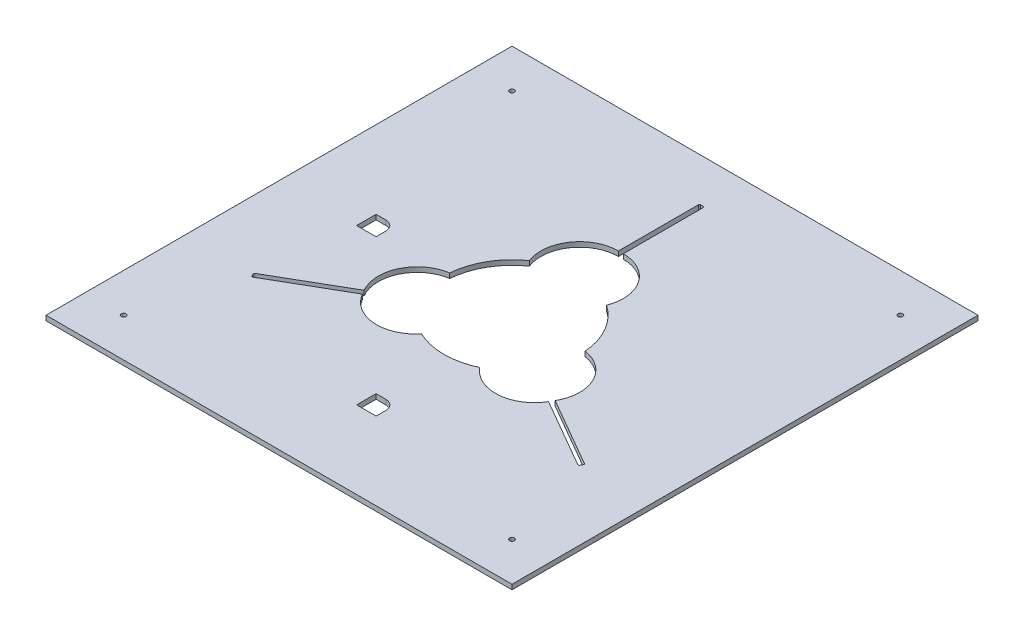
from build123d import *

# Parameters (mm, degrees)
SKETCH1_W           = 609.6
SKETCH1_H           = 609.6
BOSS_EXTRUDE1_DEPTH = 6.35
CUT_EXTRUDE2_DEPTH  = 432.099063441
SKETCH4_W           = 25.4
SKETCH4_H           = 25.4
CUT_EXTRUDE8_DEPTH  = 432.099063441
FILLET4_R           = 12.7
FILLET5_R           = 12.7
SKETCH5_R           = 3.175
CUT_EXTRUDE9_DEPTH  = 432.099063441
FILLET9_R           = 1.5875


with BuildPart() as part:
    # Sketch1 → Boss-Extrude1 (new body)
    with BuildSketch(Plane(origin=(0, 0, 0), x_dir=(1, 0, 0), z_dir=(0, 1, 0))):
        Rectangle(SKETCH1_W, SKETCH1_H)
    extrude(amount=BOSS_EXTRUDE1_DEPTH)

    # Sketch3 → Cut-Extrude2 (cut, through all)
    with BuildSketch(Plane(origin=(0, 0, 0), x_dir=(1, 0, 0), z_dir=(0, 1, 0))):
        with BuildLine():
            Line((-3.175, 248.4755), (-3.175, 142.454689298))
            ThreePointArc((-3.175, 142.454689298), (-45.125573361, 120.304111538), (-50.492310608, 73.169232396))
            ThreePointArc((-50.492310608, 73.169232396), (-76.989658396, 44.45), (-88.612569335, 7.143007484))
            ThreePointArc((-88.612569335, 7.143007484), (-126.749203452, -21.072162878), (-124.95687982, -68.477713992))
            Line((-124.95687982, -68.477713992), (-216.773595218, -121.488119343))
            Line((-216.773595218, -121.488119343), (-213.598595218, -126.987380657))
            Line((-213.598595218, -126.987380657), (-121.78187982, -73.976975306))
            ThreePointArc((-121.78187982, -73.976975306), (-81.623630091, -99.23194866), (-38.120258727, -80.31223988))
            ThreePointArc((-38.120258727, -80.31223988), (0, -88.9), (38.120258727, -80.31223988))
            ThreePointArc((38.120258727, -80.31223988), (81.623630091, -99.23194866), (121.78187982, -73.976975306))
            Line((121.78187982, -73.976975306), (213.598595218, -126.987380657))
            Line((213.598595218, -126.987380657), (216.773595218, -121.488119343))
            Line((216.773595218, -121.488119343), (124.95687982, -68.477713992))
            ThreePointArc((124.95687982, -68.477713992), (126.749203452, -21.072162878), (88.612569335, 7.143007484))
            ThreePointArc((88.612569335, 7.143007484), (76.989658396, 44.45), (50.492310608, 73.169232396))
            ThreePointArc((50.492310608, 73.169232396), (45.125573361, 120.304111538), (3.175, 142.454689298))
            Line((3.175, 142.454689298), (3.175, 248.4755))
            Line((3.175, 248.4755), (-3.175, 248.4755))
        make_face()
    extrude(amount=CUT_EXTRUDE2_DEPTH, mode=Mode.SUBTRACT)

    # Sketch4 → Cut-Extrude8 (cut, through all)
    with BuildSketch(Plane(origin=(0, 0, 0), x_dir=(1, 0, 0), z_dir=(0, 1, 0))):
        with Locations((12.7, -190.5)):
            Rectangle(SKETCH4_W, SKETCH4_H)
        with Locations((-190.5, 12.7)):
            Rectangle(SKETCH4_W, SKETCH4_H)
    extrude(amount=CUT_EXTRUDE8_DEPTH, mode=Mode.SUBTRACT)

    # Fillet4
    fillet4_edges = [part.edges().sort_by_distance(p)[0] for p in [
        (-177.8, 3.175, -25.4),
    ]]
    fillet(fillet4_edges, radius=FILLET4_R)

    # Fillet5
    fillet5_edges = [part.edges().sort_by_distance(p)[0] for p in [
        (25.4, 3.175, 177.8),
    ]]
    fillet(fillet5_edges, radius=FILLET5_R)

    # Sketch5 → Cut-Extrude9 (cut, through all)
    with BuildSketch(Plane(origin=(0, 6.35, 0), x_dir=(1, 0, 0), z_dir=(0, 1, 0))):
        with Locations((-254, 254)):
            Circle(SKETCH5_R)
        with Locations((254, 254)):
            Circle(SKETCH5_R)
        with Locations((254, -254)):
            Circle(SKETCH5_R)
        with Locations((-254, -254)):
            Circle(SKETCH5_R)
    extrude(amount=-CUT_EXTRUDE9_DEPTH, mode=Mode.SUBTRACT)

    # Fillet9
    fillet9_edges = [part.edges().sort_by_distance(p)[0] for p in [
        (216.773595218, 3.175, 121.488119343),
        (213.598595218, 3.175, 126.987380657),
        (-216.773595218, 3.175, 121.488119343),
        (-213.598595218, 3.175, 126.987380657),
        (3.175, 3.175, -248.4755),
        (-3.175, 3.175, -248.4755),
    ]]
    fillet(fillet9_edges, radius=FILLET9_R)


solid = part.part
